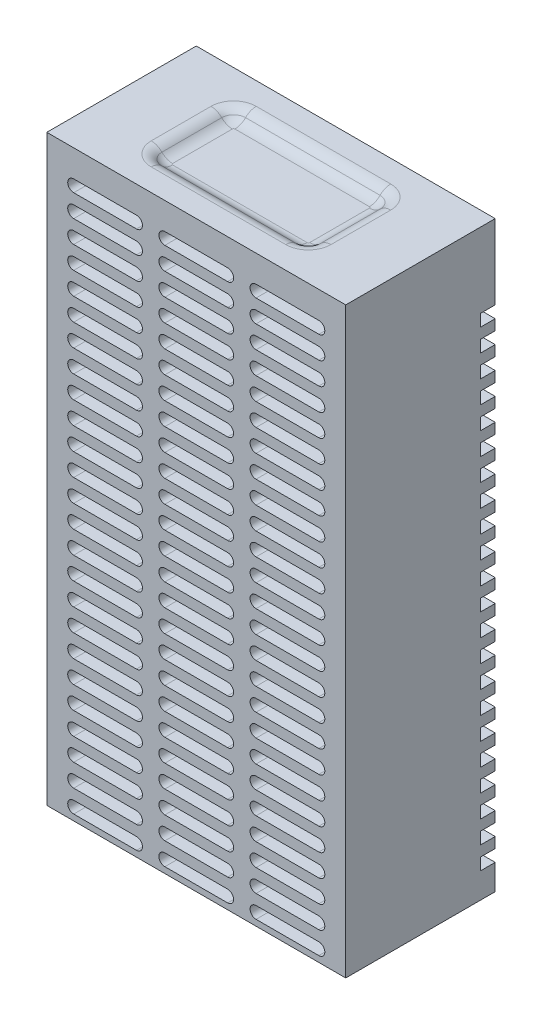
from build123d import *

# Parameters (mm, degrees)
SKETCH1_W           = 100
SKETCH1_H           = 195
BOSS_EXTRUDE1_DEPTH = 50
CUT_EXTRUDE1_DEPTH  = 20
CUT_EXTRUDE2_DEPTH  = 5
CUT_EXTRUDE3_DEPTH  = 3
FILLET2_R           = 5
FILLET3_R           = 5


with BuildPart() as part:
    # Sketch1 → Boss-Extrude1 (new body)
    with BuildSketch(Plane.XY):
        Rectangle(SKETCH1_W, SKETCH1_H)
    extrude(amount=BOSS_EXTRUDE1_DEPTH)

    # Sketch2 → Cut-Extrude1 (cut)
    with BuildSketch(Plane.XY.offset(50)):
        with BuildLine():
            Line((10.5, 84.5), (-10.5, 84.5))
            ThreePointArc((-10.5, 84.5), (-12.5, 86.5), (-10.5, 88.5))
            Line((-10.5, 88.5), (10.5, 88.5))
            ThreePointArc((10.5, 88.5), (12.5, 86.5), (10.5, 84.5))
        make_face()
        with BuildLine():
            Line((-41, 88.5), (-20, 88.5))
            ThreePointArc((-20, 88.5), (-18, 86.5), (-20, 84.5))
            Line((-20, 84.5), (-41, 84.5))
            ThreePointArc((-41, 84.5), (-43, 86.5), (-41, 88.5))
        make_face()
        with BuildLine():
            Line((41, 88.5), (20, 88.5))
            ThreePointArc((20, 88.5), (18, 86.5), (20, 84.5))
            Line((20, 84.5), (41, 84.5))
            ThreePointArc((41, 84.5), (43, 86.5), (41, 88.5))
        make_face()
        with BuildLine():
            Line((10.5, 77), (-10.5, 77))
            ThreePointArc((-10.5, 77), (-12.5, 79), (-10.5, 81))
            Line((-10.5, 81), (10.5, 81))
            ThreePointArc((10.5, 81), (12.5, 79), (10.5, 77))
        make_face()
        with BuildLine():
            Line((-41, 81), (-20, 81))
            ThreePointArc((-20, 81), (-18, 79), (-20, 77))
            Line((-20, 77), (-41, 77))
            ThreePointArc((-41, 77), (-43, 79), (-41, 81))
        make_face()
        with BuildLine():
            Line((41, 81), (20, 81))
            ThreePointArc((20, 81), (18, 79), (20, 77))
            Line((20, 77), (41, 77))
            ThreePointArc((41, 77), (43, 79), (41, 81))
        make_face()
        with BuildLine():
            Line((10.5, 69.5), (-10.5, 69.5))
            ThreePointArc((-10.5, 69.5), (-12.5, 71.5), (-10.5, 73.5))
            Line((-10.5, 73.5), (10.5, 73.5))
            ThreePointArc((10.5, 73.5), (12.5, 71.5), (10.5, 69.5))
        make_face()
        with BuildLine():
            Line((-41, 73.5), (-20, 73.5))
            ThreePointArc((-20, 73.5), (-18, 71.5), (-20, 69.5))
            Line((-20, 69.5), (-41, 69.5))
            ThreePointArc((-41, 69.5), (-43, 71.5), (-41, 73.5))
        make_face()
        with BuildLine():
            Line((41, 73.5), (20, 73.5))
            ThreePointArc((20, 73.5), (18, 71.5), (20, 69.5))
            Line((20, 69.5), (41, 69.5))
            ThreePointArc((41, 69.5), (43, 71.5), (41, 73.5))
        make_face()
        with BuildLine():
            Line((10.5, 62), (-10.5, 62))
            ThreePointArc((-10.5, 62), (-12.5, 64), (-10.5, 66))
            Line((-10.5, 66), (10.5, 66))
            ThreePointArc((10.5, 66), (12.5, 64), (10.5, 62))
        make_face()
        with BuildLine():
            Line((-41, 66), (-20, 66))
            ThreePointArc((-20, 66), (-18, 64), (-20, 62))
            Line((-20, 62), (-41, 62))
            ThreePointArc((-41, 62), (-43, 64), (-41, 66))
        make_face()
        with BuildLine():
            Line((41, 66), (20, 66))
            ThreePointArc((20, 66), (18, 64), (20, 62))
            Line((20, 62), (41, 62))
            ThreePointArc((41, 62), (43, 64), (41, 66))
        make_face()
        with BuildLine():
            Line((10.5, 54.5), (-10.5, 54.5))
            ThreePointArc((-10.5, 54.5), (-12.5, 56.5), (-10.5, 58.5))
            Line((-10.5, 58.5), (10.5, 58.5))
            ThreePointArc((10.5, 58.5), (12.5, 56.5), (10.5, 54.5))
        make_face()
        with BuildLine():
            Line((-41, 58.5), (-20, 58.5))
            ThreePointArc((-20, 58.5), (-18, 56.5), (-20, 54.5))
            Line((-20, 54.5), (-41, 54.5))
            ThreePointArc((-41, 54.5), (-43, 56.5), (-41, 58.5))
        make_face()
        with BuildLine():
            Line((41, 58.5), (20, 58.5))
            ThreePointArc((20, 58.5), (18, 56.5), (20, 54.5))
            Line((20, 54.5), (41, 54.5))
            ThreePointArc((41, 54.5), (43, 56.5), (41, 58.5))
        make_face()
        with BuildLine():
            Line((10.5, 47), (-10.5, 47))
            ThreePointArc((-10.5, 47), (-12.5, 49), (-10.5, 51))
            Line((-10.5, 51), (10.5, 51))
            ThreePointArc((10.5, 51), (12.5, 49), (10.5, 47))
        make_face()
        with BuildLine():
            Line((-41, 51), (-20, 51))
            ThreePointArc((-20, 51), (-18, 49), (-20, 47))
            Line((-20, 47), (-41, 47))
            ThreePointArc((-41, 47), (-43, 49), (-41, 51))
        make_face()
        with BuildLine():
            Line((41, 51), (20, 51))
            ThreePointArc((20, 51), (18, 49), (20, 47))
            Line((20, 47), (41, 47))
            ThreePointArc((41, 47), (43, 49), (41, 51))
        make_face()
        with BuildLine():
            Line((10.5, 39.5), (-10.5, 39.5))
            ThreePointArc((-10.5, 39.5), (-12.5, 41.5), (-10.5, 43.5))
            Line((-10.5, 43.5), (10.5, 43.5))
            ThreePointArc((10.5, 43.5), (12.5, 41.5), (10.5, 39.5))
        make_face()
        with BuildLine():
            Line((-41, 43.5), (-20, 43.5))
            ThreePointArc((-20, 43.5), (-18, 41.5), (-20, 39.5))
            Line((-20, 39.5), (-41, 39.5))
            ThreePointArc((-41, 39.5), (-43, 41.5), (-41, 43.5))
        make_face()
        with BuildLine():
            Line((41, 43.5), (20, 43.5))
            ThreePointArc((20, 43.5), (18, 41.5), (20, 39.5))
            Line((20, 39.5), (41, 39.5))
            ThreePointArc((41, 39.5), (43, 41.5), (41, 43.5))
        make_face()
        with BuildLine():
            Line((10.5, 32), (-10.5, 32))
            ThreePointArc((-10.5, 32), (-12.5, 34), (-10.5, 36))
            Line((-10.5, 36), (10.5, 36))
            ThreePointArc((10.5, 36), (12.5, 34), (10.5, 32))
        make_face()
        with BuildLine():
            Line((-41, 36), (-20, 36))
            ThreePointArc((-20, 36), (-18, 34), (-20, 32))
            Line((-20, 32), (-41, 32))
            ThreePointArc((-41, 32), (-43, 34), (-41, 36))
        make_face()
        with BuildLine():
            Line((41, 36), (20, 36))
            ThreePointArc((20, 36), (18, 34), (20, 32))
            Line((20, 32), (41, 32))
            ThreePointArc((41, 32), (43, 34), (41, 36))
        make_face()
        with BuildLine():
            Line((10.5, 24.5), (-10.5, 24.5))
            ThreePointArc((-10.5, 24.5), (-12.5, 26.5), (-10.5, 28.5))
            Line((-10.5, 28.5), (10.5, 28.5))
            ThreePointArc((10.5, 28.5), (12.5, 26.5), (10.5, 24.5))
        make_face()
        with BuildLine():
            Line((-41, 28.5), (-20, 28.5))
            ThreePointArc((-20, 28.5), (-18, 26.5), (-20, 24.5))
            Line((-20, 24.5), (-41, 24.5))
            ThreePointArc((-41, 24.5), (-43, 26.5), (-41, 28.5))
        make_face()
        with BuildLine():
            Line((41, 28.5), (20, 28.5))
            ThreePointArc((20, 28.5), (18, 26.5), (20, 24.5))
            Line((20, 24.5), (41, 24.5))
            ThreePointArc((41, 24.5), (43, 26.5), (41, 28.5))
        make_face()
        with BuildLine():
            Line((10.5, 17), (-10.5, 17))
            ThreePointArc((-10.5, 17), (-12.5, 19), (-10.5, 21))
            Line((-10.5, 21), (10.5, 21))
            ThreePointArc((10.5, 21), (12.5, 19), (10.5, 17))
        make_face()
        with BuildLine():
            Line((-41, 21), (-20, 21))
            ThreePointArc((-20, 21), (-18, 19), (-20, 17))
            Line((-20, 17), (-41, 17))
            ThreePointArc((-41, 17), (-43, 19), (-41, 21))
        make_face()
        with BuildLine():
            Line((41, 21), (20, 21))
            ThreePointArc((20, 21), (18, 19), (20, 17))
            Line((20, 17), (41, 17))
            ThreePointArc((41, 17), (43, 19), (41, 21))
        make_face()
        with BuildLine():
            Line((10.5, 9.5), (-10.5, 9.5))
            ThreePointArc((-10.5, 9.5), (-12.5, 11.5), (-10.5, 13.5))
            Line((-10.5, 13.5), (10.5, 13.5))
            ThreePointArc((10.5, 13.5), (12.5, 11.5), (10.5, 9.5))
        make_face()
        with BuildLine():
            Line((-41, 13.5), (-20, 13.5))
            ThreePointArc((-20, 13.5), (-18, 11.5), (-20, 9.5))
            Line((-20, 9.5), (-41, 9.5))
            ThreePointArc((-41, 9.5), (-43, 11.5), (-41, 13.5))
        make_face()
        with BuildLine():
            Line((41, 13.5), (20, 13.5))
            ThreePointArc((20, 13.5), (18, 11.5), (20, 9.5))
            Line((20, 9.5), (41, 9.5))
            ThreePointArc((41, 9.5), (43, 11.5), (41, 13.5))
        make_face()
        with BuildLine():
            Line((10.5, 2), (-10.5, 2))
            ThreePointArc((-10.5, 2), (-12.5, 4), (-10.5, 6))
            Line((-10.5, 6), (10.5, 6))
            ThreePointArc((10.5, 6), (12.5, 4), (10.5, 2))
        make_face()
        with BuildLine():
            Line((-41, 6), (-20, 6))
            ThreePointArc((-20, 6), (-18, 4), (-20, 2))
            Line((-20, 2), (-41, 2))
            ThreePointArc((-41, 2), (-43, 4), (-41, 6))
        make_face()
        with BuildLine():
            Line((41, 6), (20, 6))
            ThreePointArc((20, 6), (18, 4), (20, 2))
            Line((20, 2), (41, 2))
            ThreePointArc((41, 2), (43, 4), (41, 6))
        make_face()
        with BuildLine():
            Line((10.5, -5.5), (-10.5, -5.5))
            ThreePointArc((-10.5, -5.5), (-12.5, -3.5), (-10.5, -1.5))
            Line((-10.5, -1.5), (10.5, -1.5))
            ThreePointArc((10.5, -1.5), (12.5, -3.5), (10.5, -5.5))
        make_face()
        with BuildLine():
            Line((-41, -1.5), (-20, -1.5))
            ThreePointArc((-20, -1.5), (-18, -3.5), (-20, -5.5))
            Line((-20, -5.5), (-41, -5.5))
            ThreePointArc((-41, -5.5), (-43, -3.5), (-41, -1.5))
        make_face()
        with BuildLine():
            Line((41, -1.5), (20, -1.5))
            ThreePointArc((20, -1.5), (18, -3.5), (20, -5.5))
            Line((20, -5.5), (41, -5.5))
            ThreePointArc((41, -5.5), (43, -3.5), (41, -1.5))
        make_face()
        with BuildLine():
            Line((10.5, -13), (-10.5, -13))
            ThreePointArc((-10.5, -13), (-12.5, -11), (-10.5, -9))
            Line((-10.5, -9), (10.5, -9))
            ThreePointArc((10.5, -9), (12.5, -11), (10.5, -13))
        make_face()
        with BuildLine():
            Line((-41, -9), (-20, -9))
            ThreePointArc((-20, -9), (-18, -11), (-20, -13))
            Line((-20, -13), (-41, -13))
            ThreePointArc((-41, -13), (-43, -11), (-41, -9))
        make_face()
        with BuildLine():
            Line((41, -9), (20, -9))
            ThreePointArc((20, -9), (18, -11), (20, -13))
            Line((20, -13), (41, -13))
            ThreePointArc((41, -13), (43, -11), (41, -9))
        make_face()
        with BuildLine():
            Line((10.5, -20.5), (-10.5, -20.5))
            ThreePointArc((-10.5, -20.5), (-12.5, -18.5), (-10.5, -16.5))
            Line((-10.5, -16.5), (10.5, -16.5))
            ThreePointArc((10.5, -16.5), (12.5, -18.5), (10.5, -20.5))
        make_face()
        with BuildLine():
            Line((-41, -16.5), (-20, -16.5))
            ThreePointArc((-20, -16.5), (-18, -18.5), (-20, -20.5))
            Line((-20, -20.5), (-41, -20.5))
            ThreePointArc((-41, -20.5), (-43, -18.5), (-41, -16.5))
        make_face()
        with BuildLine():
            Line((41, -16.5), (20, -16.5))
            ThreePointArc((20, -16.5), (18, -18.5), (20, -20.5))
            Line((20, -20.5), (41, -20.5))
            ThreePointArc((41, -20.5), (43, -18.5), (41, -16.5))
        make_face()
        with BuildLine():
            Line((10.5, -28), (-10.5, -28))
            ThreePointArc((-10.5, -28), (-12.5, -26), (-10.5, -24))
            Line((-10.5, -24), (10.5, -24))
            ThreePointArc((10.5, -24), (12.5, -26), (10.5, -28))
        make_face()
        with BuildLine():
            Line((-41, -24), (-20, -24))
            ThreePointArc((-20, -24), (-18, -26), (-20, -28))
            Line((-20, -28), (-41, -28))
            ThreePointArc((-41, -28), (-43, -26), (-41, -24))
        make_face()
        with BuildLine():
            Line((41, -24), (20, -24))
            ThreePointArc((20, -24), (18, -26), (20, -28))
            Line((20, -28), (41, -28))
            ThreePointArc((41, -28), (43, -26), (41, -24))
        make_face()
        with BuildLine():
            Line((10.5, -35.5), (-10.5, -35.5))
            ThreePointArc((-10.5, -35.5), (-12.5, -33.5), (-10.5, -31.5))
            Line((-10.5, -31.5), (10.5, -31.5))
            ThreePointArc((10.5, -31.5), (12.5, -33.5), (10.5, -35.5))
        make_face()
        with BuildLine():
            Line((-41, -31.5), (-20, -31.5))
            ThreePointArc((-20, -31.5), (-18, -33.5), (-20, -35.5))
            Line((-20, -35.5), (-41, -35.5))
            ThreePointArc((-41, -35.5), (-43, -33.5), (-41, -31.5))
        make_face()
        with BuildLine():
            Line((41, -31.5), (20, -31.5))
            ThreePointArc((20, -31.5), (18, -33.5), (20, -35.5))
            Line((20, -35.5), (41, -35.5))
            ThreePointArc((41, -35.5), (43, -33.5), (41, -31.5))
        make_face()
        with BuildLine():
            Line((10.5, -43), (-10.5, -43))
            ThreePointArc((-10.5, -43), (-12.5, -41), (-10.5, -39))
            Line((-10.5, -39), (10.5, -39))
            ThreePointArc((10.5, -39), (12.5, -41), (10.5, -43))
        make_face()
        with BuildLine():
            Line((-41, -39), (-20, -39))
            ThreePointArc((-20, -39), (-18, -41), (-20, -43))
            Line((-20, -43), (-41, -43))
            ThreePointArc((-41, -43), (-43, -41), (-41, -39))
        make_face()
        with BuildLine():
            Line((41, -39), (20, -39))
            ThreePointArc((20, -39), (18, -41), (20, -43))
            Line((20, -43), (41, -43))
            ThreePointArc((41, -43), (43, -41), (41, -39))
        make_face()
        with BuildLine():
            Line((10.5, -50.5), (-10.5, -50.5))
            ThreePointArc((-10.5, -50.5), (-12.5, -48.5), (-10.5, -46.5))
            Line((-10.5, -46.5), (10.5, -46.5))
            ThreePointArc((10.5, -46.5), (12.5, -48.5), (10.5, -50.5))
        make_face()
        with BuildLine():
            Line((-41, -46.5), (-20, -46.5))
            ThreePointArc((-20, -46.5), (-18, -48.5), (-20, -50.5))
            Line((-20, -50.5), (-41, -50.5))
            ThreePointArc((-41, -50.5), (-43, -48.5), (-41, -46.5))
        make_face()
        with BuildLine():
            Line((41, -46.5), (20, -46.5))
            ThreePointArc((20, -46.5), (18, -48.5), (20, -50.5))
            Line((20, -50.5), (41, -50.5))
            ThreePointArc((41, -50.5), (43, -48.5), (41, -46.5))
        make_face()
        with BuildLine():
            Line((10.5, -58), (-10.5, -58))
            ThreePointArc((-10.5, -58), (-12.5, -56), (-10.5, -54))
            Line((-10.5, -54), (10.5, -54))
            ThreePointArc((10.5, -54), (12.5, -56), (10.5, -58))
        make_face()
        with BuildLine():
            Line((-41, -54), (-20, -54))
            ThreePointArc((-20, -54), (-18, -56), (-20, -58))
            Line((-20, -58), (-41, -58))
            ThreePointArc((-41, -58), (-43, -56), (-41, -54))
        make_face()
        with BuildLine():
            Line((41, -54), (20, -54))
            ThreePointArc((20, -54), (18, -56), (20, -58))
            Line((20, -58), (41, -58))
            ThreePointArc((41, -58), (43, -56), (41, -54))
        make_face()
        with BuildLine():
            Line((10.5, -65.5), (-10.5, -65.5))
            ThreePointArc((-10.5, -65.5), (-12.5, -63.5), (-10.5, -61.5))
            Line((-10.5, -61.5), (10.5, -61.5))
            ThreePointArc((10.5, -61.5), (12.5, -63.5), (10.5, -65.5))
        make_face()
        with BuildLine():
            Line((-41, -61.5), (-20, -61.5))
            ThreePointArc((-20, -61.5), (-18, -63.5), (-20, -65.5))
            Line((-20, -65.5), (-41, -65.5))
            ThreePointArc((-41, -65.5), (-43, -63.5), (-41, -61.5))
        make_face()
        with BuildLine():
            Line((41, -61.5), (20, -61.5))
            ThreePointArc((20, -61.5), (18, -63.5), (20, -65.5))
            Line((20, -65.5), (41, -65.5))
            ThreePointArc((41, -65.5), (43, -63.5), (41, -61.5))
        make_face()
        with BuildLine():
            Line((10.5, -73), (-10.5, -73))
            ThreePointArc((-10.5, -73), (-12.5, -71), (-10.5, -69))
            Line((-10.5, -69), (10.5, -69))
            ThreePointArc((10.5, -69), (12.5, -71), (10.5, -73))
        make_face()
        with BuildLine():
            Line((-41, -69), (-20, -69))
            ThreePointArc((-20, -69), (-18, -71), (-20, -73))
            Line((-20, -73), (-41, -73))
            ThreePointArc((-41, -73), (-43, -71), (-41, -69))
        make_face()
        with BuildLine():
            Line((41, -69), (20, -69))
            ThreePointArc((20, -69), (18, -71), (20, -73))
            Line((20, -73), (41, -73))
            ThreePointArc((41, -73), (43, -71), (41, -69))
        make_face()
        with BuildLine():
            Line((10.5, -80.5), (-10.5, -80.5))
            ThreePointArc((-10.5, -80.5), (-12.5, -78.5), (-10.5, -76.5))
            Line((-10.5, -76.5), (10.5, -76.5))
            ThreePointArc((10.5, -76.5), (12.5, -78.5), (10.5, -80.5))
        make_face()
        with BuildLine():
            Line((-41, -76.5), (-20, -76.5))
            ThreePointArc((-20, -76.5), (-18, -78.5), (-20, -80.5))
            Line((-20, -80.5), (-41, -80.5))
            ThreePointArc((-41, -80.5), (-43, -78.5), (-41, -76.5))
        make_face()
        with BuildLine():
            Line((41, -76.5), (20, -76.5))
            ThreePointArc((20, -76.5), (18, -78.5), (20, -80.5))
            Line((20, -80.5), (41, -80.5))
            ThreePointArc((41, -80.5), (43, -78.5), (41, -76.5))
        make_face()
        with BuildLine():
            Line((10.5, -88), (-10.5, -88))
            ThreePointArc((-10.5, -88), (-12.5, -86), (-10.5, -84))
            Line((-10.5, -84), (10.5, -84))
            ThreePointArc((10.5, -84), (12.5, -86), (10.5, -88))
        make_face()
        with BuildLine():
            Line((-41, -84), (-20, -84))
            ThreePointArc((-20, -84), (-18, -86), (-20, -88))
            Line((-20, -88), (-41, -88))
            ThreePointArc((-41, -88), (-43, -86), (-41, -84))
        make_face()
        with BuildLine():
            Line((41, -84), (20, -84))
            ThreePointArc((20, -84), (18, -86), (20, -88))
            Line((20, -88), (41, -88))
            ThreePointArc((41, -88), (43, -86), (41, -84))
        make_face()
        with BuildLine():
            Line((10.5, -95.5), (-10.5, -95.5))
            ThreePointArc((-10.5, -95.5), (-12.5, -93.5), (-10.5, -91.5))
            Line((-10.5, -91.5), (10.5, -91.5))
            ThreePointArc((10.5, -91.5), (12.5, -93.5), (10.5, -95.5))
        make_face()
        with BuildLine():
            Line((-41, -91.5), (-20, -91.5))
            ThreePointArc((-20, -91.5), (-18, -93.5), (-20, -95.5))
            Line((-20, -95.5), (-41, -95.5))
            ThreePointArc((-41, -95.5), (-43, -93.5), (-41, -91.5))
        make_face()
        with BuildLine():
            Line((41, -91.5), (20, -91.5))
            ThreePointArc((20, -91.5), (18, -93.5), (20, -95.5))
            Line((20, -95.5), (41, -95.5))
            ThreePointArc((41, -95.5), (43, -93.5), (41, -91.5))
        make_face()
    extrude(amount=-CUT_EXTRUDE1_DEPTH, mode=Mode.SUBTRACT)

    # Sketch3 → Cut-Extrude2 (cut)
    with BuildSketch(Plane(origin=(0, 0, 0), x_dir=(-1, 0, 0), z_dir=(0, 0, -1))):
        with BuildLine():
            Line((50, 68.5), (27, 68.5))
            ThreePointArc((27, 68.5), (25, 70.5), (27, 72.5))
            Line((27, 72.5), (50, 72.5))
            ThreePointArc((50, 72.5), (52, 70.5), (50, 68.5))
        make_face()
        with BuildLine():
            Line((-50, 68.5), (-27, 68.5))
            ThreePointArc((-27, 68.5), (-25, 70.5), (-27, 72.5))
            Line((-27, 72.5), (-50, 72.5))
            ThreePointArc((-50, 72.5), (-52, 70.5), (-50, 68.5))
        make_face()
        with BuildLine():
            Line((50, 61), (27, 61))
            ThreePointArc((27, 61), (25, 63), (27, 65))
            Line((27, 65), (50, 65))
            ThreePointArc((50, 65), (52, 63), (50, 61))
        make_face()
        with BuildLine():
            Line((-50, 61), (-27, 61))
            ThreePointArc((-27, 61), (-25, 63), (-27, 65))
            Line((-27, 65), (-50, 65))
            ThreePointArc((-50, 65), (-52, 63), (-50, 61))
        make_face()
        with BuildLine():
            Line((50, 53.5), (27, 53.5))
            ThreePointArc((27, 53.5), (25, 55.5), (27, 57.5))
            Line((27, 57.5), (50, 57.5))
            ThreePointArc((50, 57.5), (52, 55.5), (50, 53.5))
        make_face()
        with BuildLine():
            Line((-50, 53.5), (-27, 53.5))
            ThreePointArc((-27, 53.5), (-25, 55.5), (-27, 57.5))
            Line((-27, 57.5), (-50, 57.5))
            ThreePointArc((-50, 57.5), (-52, 55.5), (-50, 53.5))
        make_face()
        with BuildLine():
            Line((50, 46), (27, 46))
            ThreePointArc((27, 46), (25, 48), (27, 50))
            Line((27, 50), (50, 50))
            ThreePointArc((50, 50), (52, 48), (50, 46))
        make_face()
        with BuildLine():
            Line((-50, 46), (-27, 46))
            ThreePointArc((-27, 46), (-25, 48), (-27, 50))
            Line((-27, 50), (-50, 50))
            ThreePointArc((-50, 50), (-52, 48), (-50, 46))
        make_face()
        with BuildLine():
            Line((50, 38.5), (27, 38.5))
            ThreePointArc((27, 38.5), (25, 40.5), (27, 42.5))
            Line((27, 42.5), (50, 42.5))
            ThreePointArc((50, 42.5), (52, 40.5), (50, 38.5))
        make_face()
        with BuildLine():
            Line((-50, 38.5), (-27, 38.5))
            ThreePointArc((-27, 38.5), (-25, 40.5), (-27, 42.5))
            Line((-27, 42.5), (-50, 42.5))
            ThreePointArc((-50, 42.5), (-52, 40.5), (-50, 38.5))
        make_face()
        with BuildLine():
            Line((50, 31), (27, 31))
            ThreePointArc((27, 31), (25, 33), (27, 35))
            Line((27, 35), (50, 35))
            ThreePointArc((50, 35), (52, 33), (50, 31))
        make_face()
        with BuildLine():
            Line((-50, 31), (-27, 31))
            ThreePointArc((-27, 31), (-25, 33), (-27, 35))
            Line((-27, 35), (-50, 35))
            ThreePointArc((-50, 35), (-52, 33), (-50, 31))
        make_face()
        with BuildLine():
            Line((50, 23.5), (27, 23.5))
            ThreePointArc((27, 23.5), (25, 25.5), (27, 27.5))
            Line((27, 27.5), (50, 27.5))
            ThreePointArc((50, 27.5), (52, 25.5), (50, 23.5))
        make_face()
        with BuildLine():
            Line((-50, 23.5), (-27, 23.5))
            ThreePointArc((-27, 23.5), (-25, 25.5), (-27, 27.5))
            Line((-27, 27.5), (-50, 27.5))
            ThreePointArc((-50, 27.5), (-52, 25.5), (-50, 23.5))
        make_face()
        with BuildLine():
            Line((50, 16), (27, 16))
            ThreePointArc((27, 16), (25, 18), (27, 20))
            Line((27, 20), (50, 20))
            ThreePointArc((50, 20), (52, 18), (50, 16))
        make_face()
        with BuildLine():
            Line((-50, 16), (-27, 16))
            ThreePointArc((-27, 16), (-25, 18), (-27, 20))
            Line((-27, 20), (-50, 20))
            ThreePointArc((-50, 20), (-52, 18), (-50, 16))
        make_face()
        with BuildLine():
            Line((50, 8.5), (27, 8.5))
            ThreePointArc((27, 8.5), (25, 10.5), (27, 12.5))
            Line((27, 12.5), (50, 12.5))
            ThreePointArc((50, 12.5), (52, 10.5), (50, 8.5))
        make_face()
        with BuildLine():
            Line((-50, 8.5), (-27, 8.5))
            ThreePointArc((-27, 8.5), (-25, 10.5), (-27, 12.5))
            Line((-27, 12.5), (-50, 12.5))
            ThreePointArc((-50, 12.5), (-52, 10.5), (-50, 8.5))
        make_face()
        with BuildLine():
            Line((50, 1), (27, 1))
            ThreePointArc((27, 1), (25, 3), (27, 5))
            Line((27, 5), (50, 5))
            ThreePointArc((50, 5), (52, 3), (50, 1))
        make_face()
        with BuildLine():
            Line((-50, 1), (-27, 1))
            ThreePointArc((-27, 1), (-25, 3), (-27, 5))
            Line((-27, 5), (-50, 5))
            ThreePointArc((-50, 5), (-52, 3), (-50, 1))
        make_face()
        with BuildLine():
            Line((50, -6.5), (27, -6.5))
            ThreePointArc((27, -6.5), (25, -4.5), (27, -2.5))
            Line((27, -2.5), (50, -2.5))
            ThreePointArc((50, -2.5), (52, -4.5), (50, -6.5))
        make_face()
        with BuildLine():
            Line((-50, -6.5), (-27, -6.5))
            ThreePointArc((-27, -6.5), (-25, -4.5), (-27, -2.5))
            Line((-27, -2.5), (-50, -2.5))
            ThreePointArc((-50, -2.5), (-52, -4.5), (-50, -6.5))
        make_face()
        with BuildLine():
            Line((50, -14), (27, -14))
            ThreePointArc((27, -14), (25, -12), (27, -10))
            Line((27, -10), (50, -10))
            ThreePointArc((50, -10), (52, -12), (50, -14))
        make_face()
        with BuildLine():
            Line((-50, -14), (-27, -14))
            ThreePointArc((-27, -14), (-25, -12), (-27, -10))
            Line((-27, -10), (-50, -10))
            ThreePointArc((-50, -10), (-52, -12), (-50, -14))
        make_face()
        with BuildLine():
            Line((50, -21.5), (27, -21.5))
            ThreePointArc((27, -21.5), (25, -19.5), (27, -17.5))
            Line((27, -17.5), (50, -17.5))
            ThreePointArc((50, -17.5), (52, -19.5), (50, -21.5))
        make_face()
        with BuildLine():
            Line((-50, -21.5), (-27, -21.5))
            ThreePointArc((-27, -21.5), (-25, -19.5), (-27, -17.5))
            Line((-27, -17.5), (-50, -17.5))
            ThreePointArc((-50, -17.5), (-52, -19.5), (-50, -21.5))
        make_face()
        with BuildLine():
            Line((50, -29), (27, -29))
            ThreePointArc((27, -29), (25, -27), (27, -25))
            Line((27, -25), (50, -25))
            ThreePointArc((50, -25), (52, -27), (50, -29))
        make_face()
        with BuildLine():
            Line((-50, -29), (-27, -29))
            ThreePointArc((-27, -29), (-25, -27), (-27, -25))
            Line((-27, -25), (-50, -25))
            ThreePointArc((-50, -25), (-52, -27), (-50, -29))
        make_face()
        with BuildLine():
            Line((50, -36.5), (27, -36.5))
            ThreePointArc((27, -36.5), (25, -34.5), (27, -32.5))
            Line((27, -32.5), (50, -32.5))
            ThreePointArc((50, -32.5), (52, -34.5), (50, -36.5))
        make_face()
        with BuildLine():
            Line((-50, -36.5), (-27, -36.5))
            ThreePointArc((-27, -36.5), (-25, -34.5), (-27, -32.5))
            Line((-27, -32.5), (-50, -32.5))
            ThreePointArc((-50, -32.5), (-52, -34.5), (-50, -36.5))
        make_face()
        with BuildLine():
            Line((50, -44), (27, -44))
            ThreePointArc((27, -44), (25, -42), (27, -40))
            Line((27, -40), (50, -40))
            ThreePointArc((50, -40), (52, -42), (50, -44))
        make_face()
        with BuildLine():
            Line((-50, -44), (-27, -44))
            ThreePointArc((-27, -44), (-25, -42), (-27, -40))
            Line((-27, -40), (-50, -40))
            ThreePointArc((-50, -40), (-52, -42), (-50, -44))
        make_face()
        with BuildLine():
            Line((50, -51.5), (27, -51.5))
            ThreePointArc((27, -51.5), (25, -49.5), (27, -47.5))
            Line((27, -47.5), (50, -47.5))
            ThreePointArc((50, -47.5), (52, -49.5), (50, -51.5))
        make_face()
        with BuildLine():
            Line((-50, -51.5), (-27, -51.5))
            ThreePointArc((-27, -51.5), (-25, -49.5), (-27, -47.5))
            Line((-27, -47.5), (-50, -47.5))
            ThreePointArc((-50, -47.5), (-52, -49.5), (-50, -51.5))
        make_face()
        with BuildLine():
            Line((50, -59), (27, -59))
            ThreePointArc((27, -59), (25, -57), (27, -55))
            Line((27, -55), (50, -55))
            ThreePointArc((50, -55), (52, -57), (50, -59))
        make_face()
        with BuildLine():
            Line((-50, -59), (-27, -59))
            ThreePointArc((-27, -59), (-25, -57), (-27, -55))
            Line((-27, -55), (-50, -55))
            ThreePointArc((-50, -55), (-52, -57), (-50, -59))
        make_face()
        with BuildLine():
            Line((50, -66.5), (27, -66.5))
            ThreePointArc((27, -66.5), (25, -64.5), (27, -62.5))
            Line((27, -62.5), (50, -62.5))
            ThreePointArc((50, -62.5), (52, -64.5), (50, -66.5))
        make_face()
        with BuildLine():
            Line((-50, -66.5), (-27, -66.5))
            ThreePointArc((-27, -66.5), (-25, -64.5), (-27, -62.5))
            Line((-27, -62.5), (-50, -62.5))
            ThreePointArc((-50, -62.5), (-52, -64.5), (-50, -66.5))
        make_face()
        with BuildLine():
            Line((50, -74), (27, -74))
            ThreePointArc((27, -74), (25, -72), (27, -70))
            Line((27, -70), (50, -70))
            ThreePointArc((50, -70), (52, -72), (50, -74))
        make_face()
        with BuildLine():
            Line((-50, -74), (-27, -74))
            ThreePointArc((-27, -74), (-25, -72), (-27, -70))
            Line((-27, -70), (-50, -70))
            ThreePointArc((-50, -70), (-52, -72), (-50, -74))
        make_face()
        with BuildLine():
            Line((50, -81.5), (27, -81.5))
            ThreePointArc((27, -81.5), (25, -79.5), (27, -77.5))
            Line((27, -77.5), (50, -77.5))
            ThreePointArc((50, -77.5), (52, -79.5), (50, -81.5))
        make_face()
        with BuildLine():
            Line((-50, -81.5), (-27, -81.5))
            ThreePointArc((-27, -81.5), (-25, -79.5), (-27, -77.5))
            Line((-27, -77.5), (-50, -77.5))
            ThreePointArc((-50, -77.5), (-52, -79.5), (-50, -81.5))
        make_face()
        with BuildLine():
            Line((50, -89), (27, -89))
            ThreePointArc((27, -89), (25, -87), (27, -85))
            Line((27, -85), (50, -85))
            ThreePointArc((50, -85), (52, -87), (50, -89))
        make_face()
        with BuildLine():
            Line((-50, -89), (-27, -89))
            ThreePointArc((-27, -89), (-25, -87), (-27, -85))
            Line((-27, -85), (-50, -85))
            ThreePointArc((-50, -85), (-52, -87), (-50, -89))
        make_face()
    extrude(amount=-CUT_EXTRUDE2_DEPTH, mode=Mode.SUBTRACT)

    # Sketch4 → Cut-Extrude3 (cut)
    with BuildSketch(Plane(origin=(0, 97.5, 0), x_dir=(1, 0, 0), z_dir=(0, 1, 0))):
        with BuildLine():
            Line((22.5, -40), (-22.5, -40))
            ThreePointArc((-22.5, -40), (-26.035533906, -38.535533906), (-27.5, -35))
            Line((-27.5, -35), (-27.5, -15))
            ThreePointArc((-27.5, -15), (-26.035533906, -11.464466094), (-22.5, -10))
            Line((-22.5, -10), (22.5, -10))
            ThreePointArc((22.5, -10), (26.035533906, -11.464466094), (27.5, -15))
            Line((27.5, -15), (27.5, -35))
            ThreePointArc((27.5, -35), (26.035533906, -38.535533906), (22.5, -40))
        make_face()
    extrude(amount=-CUT_EXTRUDE3_DEPTH, mode=Mode.SUBTRACT)

    # Fillet2
    # the kernel refuses this fillet: 5 mm, written as the material it adds along each edge
    with BuildSketch(Plane(origin=(27.5, 94.5, 15), x_dir=(0, 1, 0), z_dir=(0, 0, 1)), Plane(origin=(-27.5, 94.5, 35), x_dir=(0, 1, 0), z_dir=(0, 0, -1))) as fillet2_piece_1:
        with BuildLine():
            CenterArc((5, 4.582575695), FILLET2_R, 180, 66.421821522)
            Line((0, 4.582575695), (-0.1, 4.582575695))
            Line((-0.1, 4.582575695), (-0.1, 0))
            Line((-0.1, 0), (0, -0.1))
            ThreePointArc((0, -0.1), (1.5, -0.1), (2.96, -0.091651514))
            Line((2.96, -0.091651514), (3, 0))
        make_face()
    extrude(amount=20)
    with BuildSketch(Plane(origin=(22.5, 94.5, 35), x_dir=(1, 0, 0), z_dir=(0, 0, -1))) as fillet2_piece_2:
        with BuildLine():
            CenterArc((0.417424305, -5), FILLET2_R, 23.578178478, 66.421821522)
            Line((0.417424305, 0), (0.417424305, 0.1))
            Line((0.417424305, 0.1), (5, 0.1))
            Line((5, 0.1), (5.1, 0))
            ThreePointArc((5.1, 0), (5.1, -1.5), (5.091651514, -2.96))
            Line((5.091651514, -2.96), (5, -3))
        make_face()
    revolve(axis=Axis((22.5, 94.5, 35), (0, -1, 0)), revolution_arc=90)
    with BuildSketch(Plane(origin=(22.5, 94.5, 40), x_dir=(0, 1, 0), z_dir=(-1, 0, 0)), Plane(origin=(-22.5, 94.5, 10), x_dir=(0, 1, 0), z_dir=(1, 0, 0))) as fillet2_piece_3:
        with BuildLine():
            CenterArc((5, 4.582575695), FILLET2_R, 180, 66.421821522)
            Line((0, 4.582575695), (-0.1, 4.582575695))
            Line((-0.1, 4.582575695), (-0.1, 0))
            Line((-0.1, 0), (0, -0.1))
            ThreePointArc((0, -0.1), (1.5, -0.1), (2.96, -0.091651514))
            Line((2.96, -0.091651514), (3, 0))
        make_face()
    extrude(amount=45)
    with BuildSketch(Plane(origin=(-22.5, 94.5, 35), x_dir=(0, 0, 1), z_dir=(1, 0, 0))) as fillet2_piece_4:
        with BuildLine():
            CenterArc((0.417424305, -5), FILLET2_R, 23.578178478, 66.421821522)
            Line((0.417424305, 0), (0.417424305, 0.1))
            Line((0.417424305, 0.1), (5, 0.1))
            Line((5, 0.1), (5.1, 0))
            ThreePointArc((5.1, 0), (5.1, -1.5), (5.091651514, -2.96))
            Line((5.091651514, -2.96), (5, -3))
        make_face()
    revolve(axis=Axis((-22.5, 94.5, 35), (0, -1, 0)), revolution_arc=90)
    with BuildSketch(Plane(origin=(-22.5, 94.5, 15), x_dir=(-1, 0, 0), z_dir=(0, 0, 1))) as fillet2_piece_5:
        with BuildLine():
            CenterArc((0.417424305, -5), FILLET2_R, 23.578178478, 66.421821522)
            Line((0.417424305, 0), (0.417424305, 0.1))
            Line((0.417424305, 0.1), (5, 0.1))
            Line((5, 0.1), (5.1, 0))
            ThreePointArc((5.1, 0), (5.1, -1.5), (5.091651514, -2.96))
            Line((5.091651514, -2.96), (5, -3))
        make_face()
    revolve(axis=Axis((-22.5, 94.5, 15), (0, -1, 0)), revolution_arc=90)
    with BuildSketch(Plane(origin=(22.5, 94.5, 15), x_dir=(0, 0, -1), z_dir=(-1, 0, 0))) as fillet2_piece_6:
        with BuildLine():
            CenterArc((0.417424305, -5), FILLET2_R, 23.578178478, 66.421821522)
            Line((0.417424305, 0), (0.417424305, 0.1))
            Line((0.417424305, 0.1), (5, 0.1))
            Line((5, 0.1), (5.1, 0))
            ThreePointArc((5.1, 0), (5.1, -1.5), (5.091651514, -2.96))
            Line((5.091651514, -2.96), (5, -3))
        make_face()
    revolve(axis=Axis((22.5, 94.5, 15), (0, -1, 0)), revolution_arc=90)

    # Fillet3
    fillet3_edges = [part.edges().sort_by_distance(p)[0] for p in [
        (26.035533906, 97.5, 11.464466094),
        (0, 97.5, 10),
        (-26.035533906, 97.5, 11.464466094),
        (-27.5, 97.5, 25),
        (-26.035533906, 97.5, 38.535533906),
        (0, 97.5, 40),
        (26.035533906, 97.5, 38.535533906),
        (27.5, 97.5, 25),
    ]]
    fillet(fillet3_edges, radius=FILLET3_R)


solid = part.part
